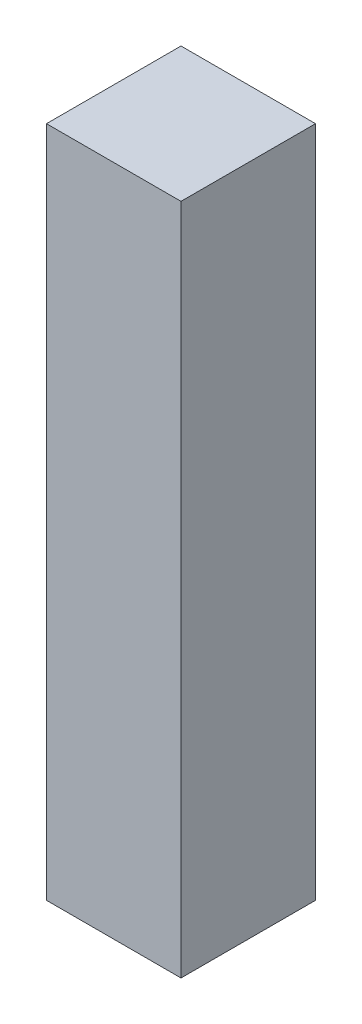
from build123d import *

# Parameters (mm, degrees)
SKETCH1_W           = 20
SKETCH1_H           = 20
BOSS_EXTRUDE1_DEPTH = 100


with BuildPart() as part:
    # Sketch1 → Boss-Extrude1 (new body)
    with BuildSketch(Plane(origin=(0, 0, 0), x_dir=(1, 0, 0), z_dir=(0, 1, 0))):
        with Locations((10, 10)):
            Rectangle(SKETCH1_W, SKETCH1_H)
    extrude(amount=BOSS_EXTRUDE1_DEPTH)


solid = part.part
